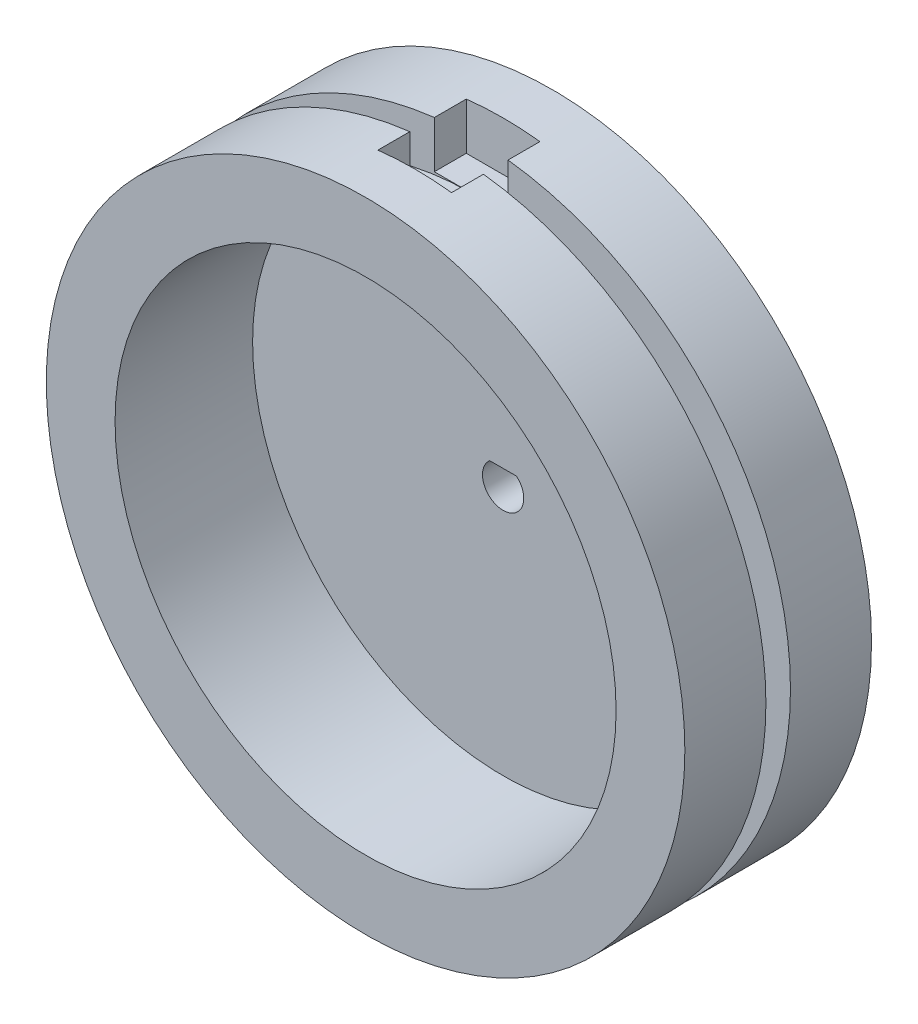
from build123d import *

# Parameters (mm, degrees)
SKETCH7_W          = 7.5
SKETCH7_H          = 9
CUT_EXTRUDE1_DEPTH = 5
SHAFT_HOLE_DEPTH   = 50.734294003


with BuildPart() as part:
    # Sketch2 → Revolve1 (revolve)
    with BuildSketch(Plane(origin=(0, 0, 0), x_dir=(0, 0, -1), z_dir=(1, 0, 0))):
        Polygon((0, 0), (0, 32.5), (-8.25, 32.5), (-8.25, 27.5), (-10.75, 27.5), (-10.75, 32.5), (-19, 32.5), (-19, 25.5), (-5, 25.5), (-5, 0), align=None)
    revolve(axis=Axis((0, 0, 5), (0, 0, -1)))

    # Sketch7 → Cut-Extrude1 (cut)
    with BuildSketch(Plane(origin=(0, 32.5, 0), x_dir=(1, 0, 0), z_dir=(0, 1, 0))):
        with Locations((0, -9.5)):
            Rectangle(SKETCH7_W, SKETCH7_H)
    cut_extrude1 = extrude(amount=-CUT_EXTRUDE1_DEPTH, mode=Mode.SUBTRACT)

    # Mirror1: Cut-Extrude1 across plane
    add(cut_extrude1.mirror(Plane.ZX), mode=Mode.SUBTRACT)

    # Sketch8 → Shaft Hole (cut, through all)
    with BuildSketch(Plane(origin=(0, 0, 0), x_dir=(-1, 0, 0), z_dir=(0, 0, -1))):
        with BuildLine():
            Line((-1.360147051, 1.6), (1.360147051, 1.6))
            ThreePointArc((1.360147051, 1.6), (0, -2.1), (-1.360147051, 1.6))
        make_face()
    extrude(amount=-SHAFT_HOLE_DEPTH, mode=Mode.SUBTRACT)


solid = part.part
